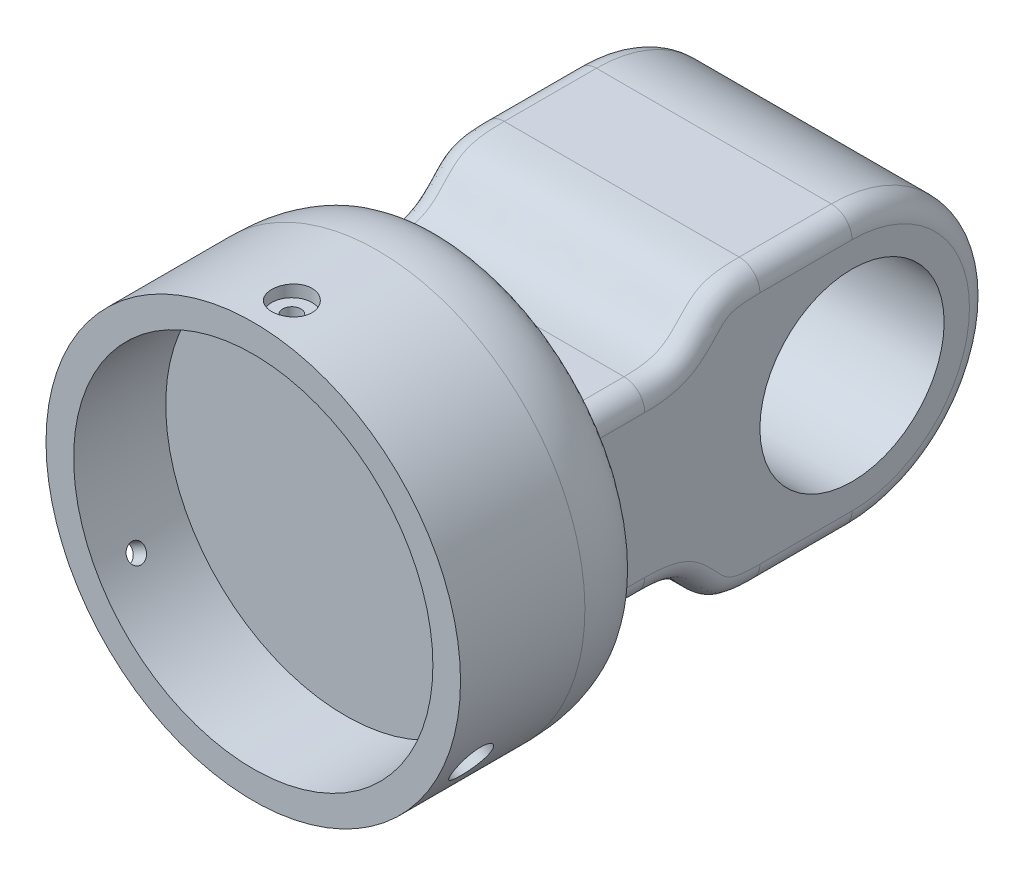
from build123d import *

# Parameters (mm, degrees)
SKETCH1_R                                = 114.3
BOSS_EXTRUDE1_DEPTH                      = 101.6
SKETCH3_R                                = 99.06
CUT_EXTRUDE1_DEPTH                       = 50.8
BOSS_EXTRUDE2_DEPTH                      = 76.2
BOSS_EXTRUDE2_DEPTH_BACK                 = 76.2
SKETCH4_R                                = 50.8
CBORE_START                              = 107.4928
CBORE_FOR_3_8_HEX_HEAD_BOLT2_OUTLINE_R   = 11.1125
CBORE_FOR_3_8_HEX_HEAD_BOLT2_DEPTH       = 6.8072001
CBORE_START_2                            = 98.931607192
CBORE_FOR_3_8_HEX_HEAD_BOLT2_2_OUTLINE_R = 5.0419
CBORE_FOR_3_8_HEX_HEAD_BOLT2_2_DEPTH     = 8.561192808
CIRPATTERN1_COUNT                        = 3
FILLET2_SIZE                             = 33.02
FILLET2_SIZE_2                           = 11.43
FILLET3_R                                = 11.43
FILLET4_R                                = 8.89


# Read off the part's stored shape, not the designer's step: CBORE for 3/8 Hex Head Bolt2
with BuildPart() as part:
    # Sketch1 → Boss-Extrude1 (new body)
    with BuildSketch(Plane.XY):
        Circle(SKETCH1_R)
    extrude(amount=BOSS_EXTRUDE1_DEPTH)

    # Sketch3 → Cut-Extrude1 (cut)
    with BuildSketch(Plane.XY.offset(101.6)):
        Circle(SKETCH3_R)
    extrude(amount=-CUT_EXTRUDE1_DEPTH, mode=Mode.SUBTRACT)

    # Sketch4 → Boss-Extrude2 (add, two sides: drawn at the far end of the back side and taken through both)
    with BuildSketch(Plane(origin=(0, 0, 0), x_dir=(0, 0, -1), z_dir=(1, 0, 0)).offset(-BOSS_EXTRUDE2_DEPTH_BACK)):
        with BuildLine():
            Line((0, -50.8), (38.1, -50.8))
            add(Edge.make_bspline(
                [(38.1, -50.8), (49.459251598, -50.8), (60.756191124, -53.400866518), (76.574660767, -74.050315653), (88.073874038, -76.2), (101.6, -76.2)],
                knots=[0, 0, 0, 0, 0.3633907, 0.590697262, 1, 1, 1, 1], degree=3))
            Line((101.6, -76.2), (152.4, -76.2))
            ThreePointArc((152.4, -76.2), (228.6, 0), (152.4, 76.2))
            Line((152.4, 76.2), (101.6, 76.2))
            add(Edge.make_bspline(
                [(38.1, 50.8), (49.459251598, 50.8), (60.756191124, 53.400866518), (76.574660767, 74.050315653), (88.073874038, 76.2), (101.6, 76.2)],
                knots=[0, 0, 0, 0, 0.3633907, 0.590697262, 1, 1, 1, 1], degree=3))
            Line((38.1, 50.8), (0, 50.8))
            Line((0, 50.8), (0, -50.8))
        make_face()
        with Locations((152.4, 0)):
            Circle(SKETCH4_R, mode=Mode.SUBTRACT)
    extrude(amount=BOSS_EXTRUDE2_DEPTH + BOSS_EXTRUDE2_DEPTH_BACK)

    # CBORE for 3/8 Hex Head Bolt2 outline → CBORE for 3/8 Hex Head Bolt2 (cut)
    with BuildSketch(Plane(origin=(0, 0, 0), x_dir=(1, 0, 0), z_dir=(0, 1, 0)).offset(CBORE_START)):
        with Locations((0, -80.321852568)):
            Circle(CBORE_FOR_3_8_HEX_HEAD_BOLT2_OUTLINE_R)
    cbore_for_3_8_hex_head_bolt2 = extrude(amount=CBORE_FOR_3_8_HEX_HEAD_BOLT2_DEPTH, mode=Mode.SUBTRACT)

    # CBORE for 3_8 Hex Head Bolt2 2 outline → CBORE for 3_8 Hex Head Bolt2 2 (cut)
    with BuildSketch(Plane(origin=(0, 0, 0), x_dir=(1, 0, 0), z_dir=(0, 1, 0)).offset(CBORE_START_2)):
        with Locations((0, -80.321852568)):
            Circle(CBORE_FOR_3_8_HEX_HEAD_BOLT2_2_OUTLINE_R)
    cbore_for_3_8_hex_head_bolt2_2 = extrude(amount=CBORE_FOR_3_8_HEX_HEAD_BOLT2_2_DEPTH, mode=Mode.SUBTRACT)

    # CirPattern1: CBORE for 3/8 Hex Head Bolt2, CBORE for 3_8 Hex Head Bolt2 2 ×3 about axis
    cirpattern1_axis = Axis((0, 0, 0), (0, 0, 1))
    add([cbore_for_3_8_hex_head_bolt2.rotate(cirpattern1_axis, i * 360 / CIRPATTERN1_COUNT) for i in range(1, CIRPATTERN1_COUNT)], mode=Mode.SUBTRACT)
    add([cbore_for_3_8_hex_head_bolt2_2.rotate(cirpattern1_axis, i * 360 / CIRPATTERN1_COUNT) for i in range(1, CIRPATTERN1_COUNT)], mode=Mode.SUBTRACT)

    # Fillet2
    # an asymmetric fillet: 33.02, 11.43 mm, written as the material it takes off along each edge
    with BuildSketch(Plane(origin=(0, 0, 0), x_dir=(1, 0, 0), z_dir=(0, -1, 0))) as fillet2_piece_1:
        with BuildLine():
            Bezier((114.3, FILLET2_SIZE), (114.3, 0), (114.3 - FILLET2_SIZE_2, 0), weights=[1, 0.707106781, 1])
            Line((114.3 - FILLET2_SIZE_2, 0), (102.87, -0.6604))
            Line((102.87, -0.6604), (114.9604, -0.6604))
            Line((114.9604, -0.6604), (114.9604, 33.02))
            Line((114.9604, 33.02), (114.3, FILLET2_SIZE))
        make_face()
    revolve(axis=Axis((0, 0, 0), (0, 0, 1)), mode=Mode.SUBTRACT)

    # Fillet3
    fillet3_edges = [part.edges().sort_by_distance(p)[0] for p in [
        (-76.2, 0, -228.6),
        (-76.2, -76.2, -127),
        (-76.2, -64.456701006, -69.410134181),
        (-76.2, -50.8, -19.05),
        (-76.2, 50.8, -19.05),
        (-76.2, 64.456701006, -69.410134181),
        (-76.2, 76.2, -127),
        (76.2, 0, -228.6),
        (76.2, 76.2, -127),
        (76.2, 64.456701006, -69.410134181),
        (76.2, 50.8, -19.05),
        (76.2, -50.8, -19.05),
        (76.2, -64.456701006, -69.410134181),
        (76.2, -76.2, -127),
    ]]
    fillet(fillet3_edges, radius=FILLET3_R)

    # Fillet4
    fillet4_edges = [part.edges().sort_by_distance(p)[0] for p in [
        (0, -50.8, 0),
        (-76.2, 0, 0),
        (0, 50.8, 0),
        (76.2, 0, 0),
        (-72.852230509, -47.452230509, 0),
        (-72.852230509, 47.452230509, 0),
        (72.852230509, -47.452230509, 0),
        (72.852230509, 47.452230509, 0),
    ]]
    fillet(fillet4_edges, radius=FILLET4_R)


solid = part.part
